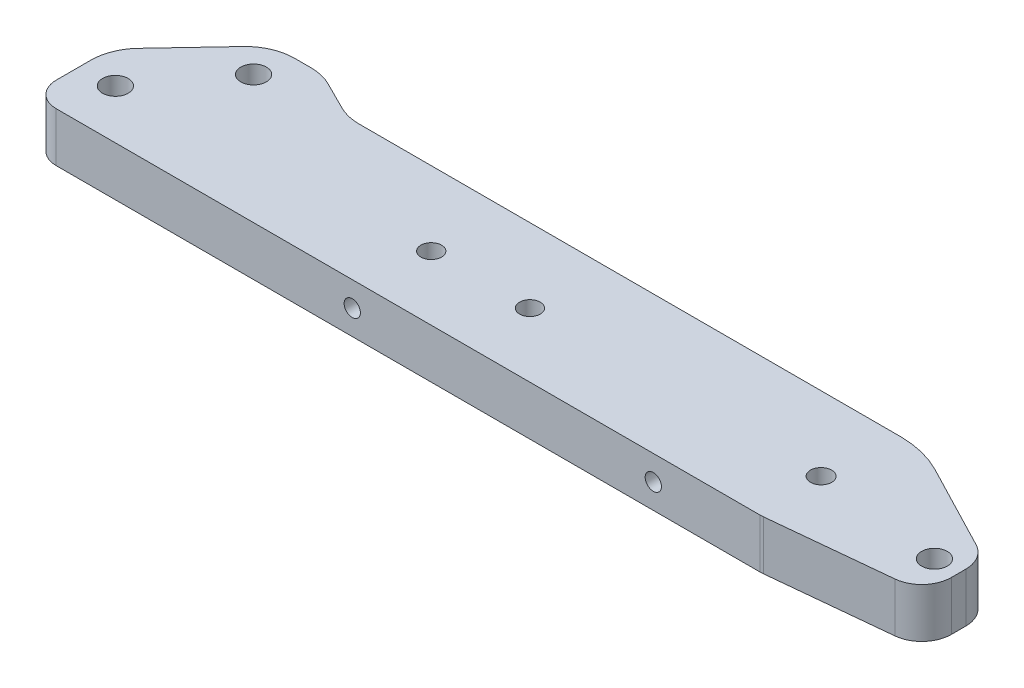
from build123d import *

# Parameters (mm, degrees)
SKETCH1_R           = 2.6
SKETCH1_R_2         = 2.15
SKETCH1_R_3         = 2.1
BOSS_EXTRUDE1_DEPTH = 10
FILLET1_R           = 5
FILLET2_R           = 6
FILLET3_R           = 10
FILLET4_R           = 20
FILLET5_R           = 10
SKETCH2_R           = 1.65
CUT_EXTRUDE1_DEPTH  = 10


with BuildPart() as part:
    # Sketch1 → Boss-Extrude1 (new body)
    with BuildSketch(Plane(origin=(0, 0, 0), x_dir=(1, 0, 0), z_dir=(0, 1, 0))):
        Polygon((159.965380006, 15), (134.965380006, 28), (18, 28), (8, 33), (-2, 33), (-18, 16), (-18, 0), (0, 0), (129.965380006, 0), (159.965380006, 3), align=None)
        with Locations(Location((-11, 10, 0), (0, 0, 270))):
            Circle(SKETCH1_R, mode=Mode.SUBTRACT)
        with Locations(Location((129, 13, 0), (0, 0, 270))):
            Circle(SKETCH1_R_2, mode=Mode.SUBTRACT)
        with Locations(Location((154.965380006, 10, 0), (0, 0, 270))):
            Circle(SKETCH1_R, mode=Mode.SUBTRACT)
        with Locations(Location((1, 26, 0), (0, 0, 270))):
            Circle(SKETCH1_R, mode=Mode.SUBTRACT)
        with Locations(Location((50, 13, 0), (0, 0, 270))):
            Circle(SKETCH1_R_3, mode=Mode.SUBTRACT)
        with Locations(Location((70, 13, 0), (0, 0, 270))):
            Circle(SKETCH1_R_3, mode=Mode.SUBTRACT)
    extrude(amount=BOSS_EXTRUDE1_DEPTH)

    # Fillet1
    fillet1_edges = [part.edges().sort_by_distance(p)[0] for p in [
        (-18, 5, 0),
    ]]
    fillet(fillet1_edges, radius=FILLET1_R)

    # Fillet2
    # the kernel refuses this fillet: 6 mm, written as the material it takes off along each edge
    with BuildSketch(Plane(origin=(159.965380006, -9.106803364, -15), x_dir=(0, 0, 1), z_dir=(0, 1, 0))) as fillet2_piece_1:
        with BuildLine():
            CenterArc((FILLET2_R * 0.607120224288, -FILLET2_R), FILLET2_R, 90, 62.525568374)
            Line((-FILLET2_R * 0.280096576946, -FILLET2_R * 0.538647263358), (0, 0))
            Line((0, 0), (FILLET2_R * 0.607120224288, 0))
        make_face()
    extrude(amount=28.213606729, mode=Mode.SUBTRACT)
    with BuildSketch(Plane(origin=(159.965380006, -13.574813432, -3), x_dir=(-0.9950371902099892, 0, 0.0995037190209987), z_dir=(0, 1, 0))) as fillet2_piece_2:
        with BuildLine():
            CenterArc((FILLET2_R * 0.904987562112, -FILLET2_R), FILLET2_R, 90, 84.289406863)
            Line((-FILLET2_R * 0.0900496280979, -FILLET2_R * 0.900496280979), (0, 0))
            Line((0, 0), (FILLET2_R * 0.904987562112, 0))
        make_face()
    extrude(amount=37.149626863, mode=Mode.SUBTRACT)
    with BuildSketch(Plane(origin=(129.965380006, -0.748134317, 0), x_dir=(-1, 0, 0), z_dir=(0, 1, 0))) as fillet2_piece_3:
        with BuildLine():
            CenterArc((FILLET2_R * 0.0498756211209, -FILLET2_R), FILLET2_R, 90, 5.710593137)
            Line((-FILLET2_R * 0.0496280979001, -FILLET2_R * 0.00496280979001), (0, 0))
            Line((0, 0), (FILLET2_R * 0.0498756211209, 0))
        make_face()
    extrude(amount=11.496268634, mode=Mode.SUBTRACT)

    # Fillet3
    fillet3_edges = [part.edges().sort_by_distance(p)[0] for p in [
        (-18, 5, -16),
        (-2, 5, -33),
    ]]
    fillet(fillet3_edges, radius=FILLET3_R)

    # Fillet4
    fillet4_edges = [part.edges().sort_by_distance(p)[0] for p in [
        (134.965380006, 5, -28),
    ]]
    fillet(fillet4_edges, radius=FILLET4_R)

    # Fillet5
    fillet5_edges = [part.edges().sort_by_distance(p)[0] for p in [
        (8, 5, -33),
        (18, 5, -28),
    ]]
    fillet(fillet5_edges, radius=FILLET5_R)

    # Sketch2 → Cut-Extrude1 (cut)
    with BuildSketch(Plane.XY):
        with Locations((47, 5)):
            Circle(SKETCH2_R)
        with Locations((108, 5)):
            Circle(SKETCH2_R)
    extrude(amount=-CUT_EXTRUDE1_DEPTH, mode=Mode.SUBTRACT)


solid = part.part
